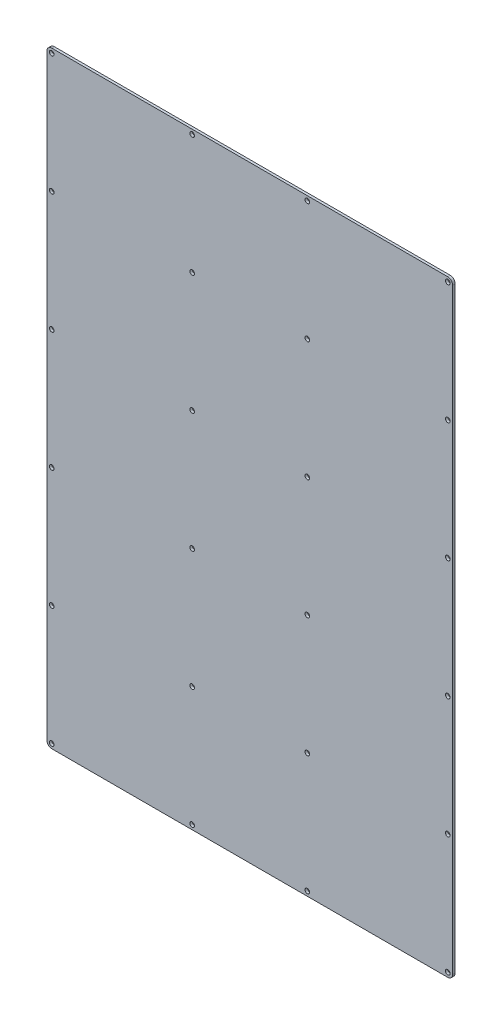
from build123d import *

# Parameters (mm, degrees)
SKETCH1_W           = 256.54
SKETCH1_H           = 383.54
BOSS_EXTRUDE1_DEPTH = 1.5875
SKETCH2_R           = 1.4732
CUT_EXTRUDE1_DEPTH  = 462.430626808
LPATTERN1_COUNT     = 6
LPATTERN1_PITCH     = 75.565
FILLET1_R           = 3.175


with BuildPart() as part:
    # Sketch1 → Boss-Extrude1 (new body)
    with BuildSketch(Plane.XY):
        with Locations((128.27, 191.77)):
            Rectangle(SKETCH1_W, SKETCH1_H)
    extrude(amount=BOSS_EXTRUDE1_DEPTH)

    # Sketch2 → Cut-Extrude1 (cut, through all)
    with BuildSketch(Plane.XY.offset(1.5875)):
        with Locations((3.0861, 380.6825)):
            Circle(SKETCH2_R)
        with Locations((91.8845, 380.6825)):
            Circle(SKETCH2_R)
        with Locations((164.6555, 380.6825)):
            Circle(SKETCH2_R)
        with Locations((253.4539, 380.6825)):
            Circle(SKETCH2_R)
    cut_extrude1 = extrude(amount=-CUT_EXTRUDE1_DEPTH, mode=Mode.SUBTRACT)

    # LPattern1: Cut-Extrude1 ×6
    with Locations(*[(0, -i * LPATTERN1_PITCH, 0) for i in range(1, LPATTERN1_COUNT)]):
        add(cut_extrude1, mode=Mode.SUBTRACT)

    # Fillet1
    fillet1_edges = [part.edges().sort_by_distance(p)[0] for p in [
        (256.54, 0, 0.79375),
        (0, 0, 0.79375),
        (256.54, 383.54, 0.79375),
        (0, 383.54, 0.79375),
    ]]
    fillet(fillet1_edges, radius=FILLET1_R)


solid = part.part
